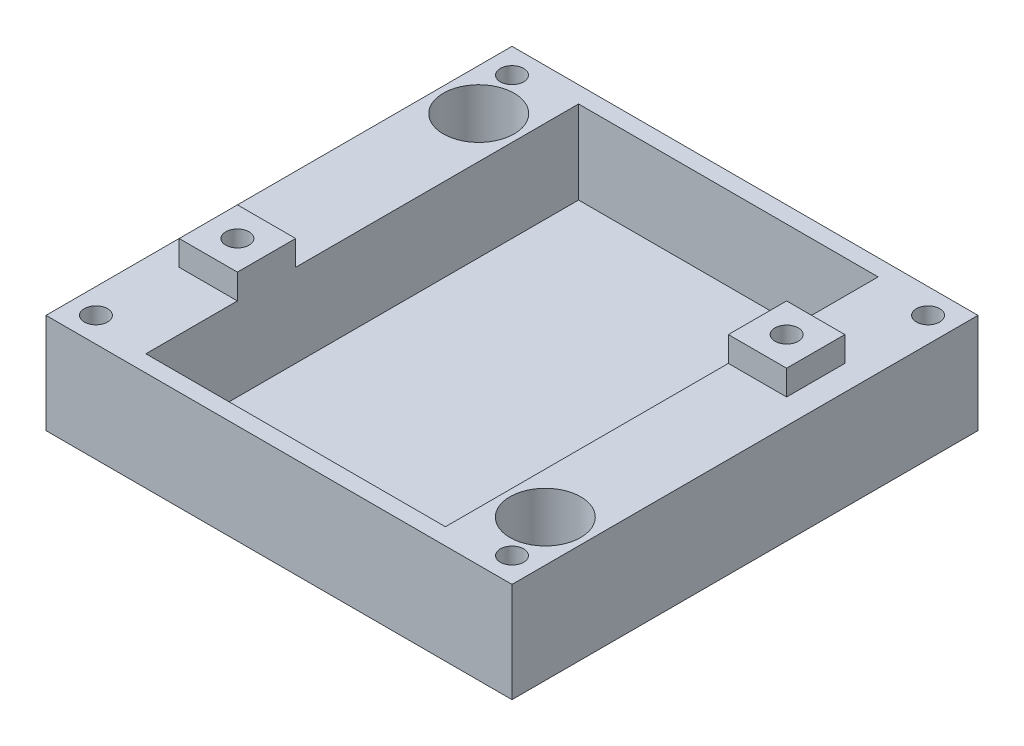
from build123d import *
from OCP.BRepFilletAPI import BRepFilletAPI_MakeChamfer

# Parameters (mm, degrees)
SKETCH_1_W          = 56
SKETCH_1_H          = 56
EXTRUDE_1_DEPTH     = 12
SKETCH_2_W          = 36
SKETCH_2_H          = 52
CUT_EXTRUDE_1_DEPTH = 10
SKETCH_4_W          = 7
SKETCH_4_H          = 7
EXTRUDE_3_DEPTH     = 3
SKETCH_5_R          = 1.4
CUT_EXTRUDE_3_DEPTH = 8
SKETCH_6_R          = 2.25
CUT_EXTRUDE_4_DEPTH = 42.376321731
SKETCH_7_R          = 4.25
CUT_EXTRUDE_5_DEPTH = 9
CHAMFER_1_SIZE      = 1.5
CHAMFER_1_SIZE_2    = 2
SKETCH_8_R          = 1.4
CUT_EXTRUDE_6_DEPTH = 8


with BuildPart() as part:
    # Эскиз1 → Бобышка-Вытянуть1 (new body)
    with BuildSketch(Plane(origin=(0, 0, 0), x_dir=(1, 0, 0), z_dir=(0, 1, 0))):
        Rectangle(SKETCH_1_W, SKETCH_1_H)
    extrude(amount=EXTRUDE_1_DEPTH)

    # Эскиз2 → Вырез-Вытянуть1 (cut)
    with BuildSketch(Plane(origin=(0, 12, 0), x_dir=(1, 0, 0), z_dir=(0, 1, 0))):
        Rectangle(SKETCH_2_W, SKETCH_2_H)
    extrude(amount=-CUT_EXTRUDE_1_DEPTH, mode=Mode.SUBTRACT)

    # Эскиз4 → Бобышка-Вытянуть3 (add)
    with BuildSketch(Plane(origin=(0, 12, 0), x_dir=(1, 0, 0), z_dir=(0, 1, 0))):
        with Locations((-21.5, -11.5)):
            Rectangle(SKETCH_4_W, SKETCH_4_H)
        with Locations((21.5, 11.5)):
            Rectangle(SKETCH_4_W, SKETCH_4_H)
    extrude(amount=EXTRUDE_3_DEPTH)

    # Эскиз5 → Вырез-Вытянуть3 (cut)
    with BuildSketch(Plane(origin=(0, 15, 0), x_dir=(1, 0, 0), z_dir=(0, 1, 0))):
        with Locations(Location((-21.5, -11.5, 0), (0, 0, 270))):
            Circle(SKETCH_5_R)
        with Locations(Location((21.5, 11.5, 0), (0, 0, 270))):
            Circle(SKETCH_5_R)
    extrude(amount=-CUT_EXTRUDE_3_DEPTH, mode=Mode.SUBTRACT)

    # Эскиз6 → Вырез-Вытянуть4 (cut, through all)
    with BuildSketch(Plane(origin=(0, 12, 0), x_dir=(1, 0, 0), z_dir=(0, 1, 0))):
        with Locations(Location((-23, 19, 0), (0, 0, 270))):
            Circle(SKETCH_6_R)
        with Locations(Location((23, -19, 0), (0, 0, 270))):
            Circle(SKETCH_6_R)
    extrude(amount=-CUT_EXTRUDE_4_DEPTH, mode=Mode.SUBTRACT)

    # Эскиз7 → Вырез-Вытянуть5 (cut)
    with BuildSketch(Plane(origin=(0, 12, 0), x_dir=(1, 0, 0), z_dir=(0, 1, 0))):
        with Locations(Location((-23, 19, 0), (0, 0, 270))):
            Circle(SKETCH_7_R)
        with Locations(Location((23, -19, 0), (0, 0, 270))):
            Circle(SKETCH_7_R)
    extrude(amount=-CUT_EXTRUDE_5_DEPTH, mode=Mode.SUBTRACT)

    # Фаска1
    chamfer_1_edges_1 = [part.edges().sort_by_distance(p)[0] for p in [
        (-23, 3, -21.25),
    ]]
    chamfer_1_side_1 = [part.faces().sort_by_distance(p)[0] for p in [
        (-23, 2.97, -21.25),
    ]]
    chamfer_1_edges_2 = [part.edges().sort_by_distance(p)[0] for p in [
        (23, 3, 16.75),
    ]]
    chamfer_1_side_2 = [part.faces().sort_by_distance(p)[0] for p in [
        (23, 2.97, 16.75),
    ]]
    chamfer_1 = BRepFilletAPI_MakeChamfer(part.part.solid().wrapped)
    for e in chamfer_1_edges_1:
        chamfer_1.Add(CHAMFER_1_SIZE - 0.0001, CHAMFER_1_SIZE_2 - 0.0001, e.wrapped, chamfer_1_side_1[0].wrapped)
    for e in chamfer_1_edges_2:
        chamfer_1.Add(CHAMFER_1_SIZE - 0.0001, CHAMFER_1_SIZE_2 - 0.0001, e.wrapped, chamfer_1_side_2[0].wrapped)
    add(Compound.cast(chamfer_1.Shape()), mode=Mode.REPLACE)  # a hair under: the kernel refuses the full size

    # Эскиз8 → Вырез-Вытянуть6 (cut)
    with BuildSketch(Plane(origin=(0, 12, 0), x_dir=(1, 0, 0), z_dir=(0, 1, 0))):
        with Locations(Location((-25, 25, 0), (0, 0, 270))):
            Circle(SKETCH_8_R)
        with Locations(Location((25, -25, 0), (0, 0, 270))):
            Circle(SKETCH_8_R)
        with Locations(Location((-25, -25, 0), (0, 0, 270))):
            Circle(SKETCH_8_R)
        with Locations(Location((25, 25, 0), (0, 0, 270))):
            Circle(SKETCH_8_R)
    extrude(amount=-CUT_EXTRUDE_6_DEPTH, mode=Mode.SUBTRACT)


solid = part.part
